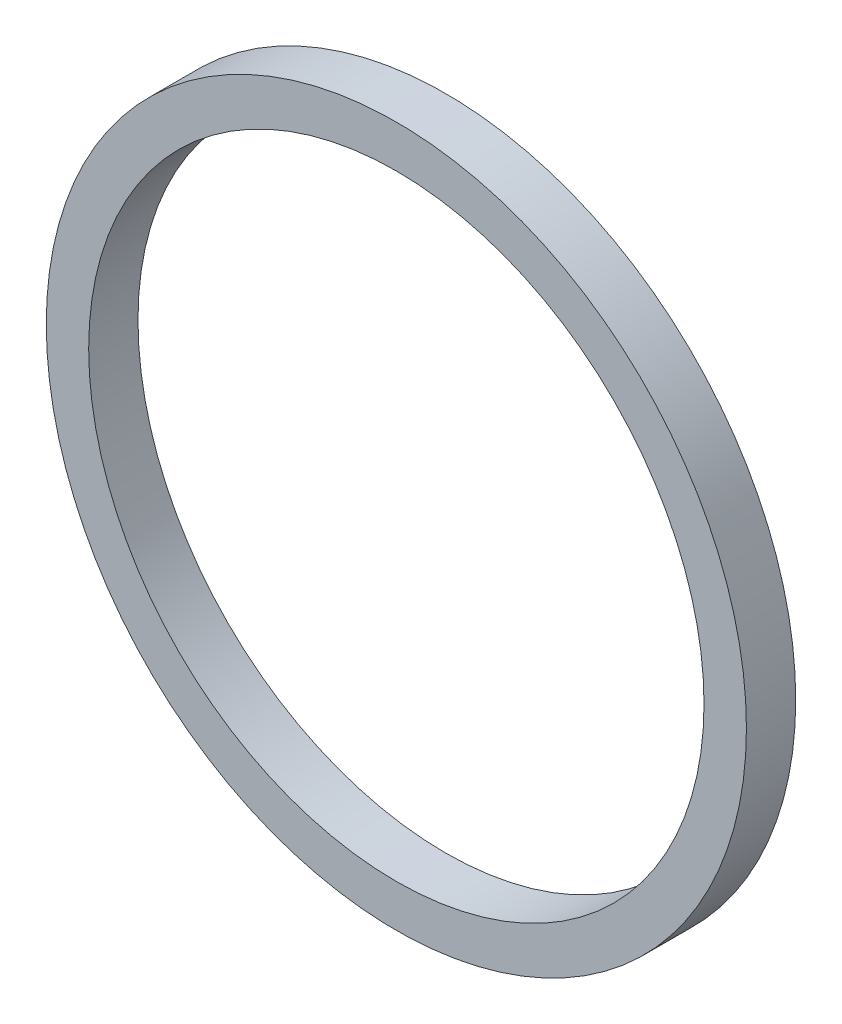
from build123d import *

# Parameters (mm, degrees)
SKETCH1_R           = 22.5425
SKETCH1_R_2         = 19.812
BOSS_EXTRUDE1_DEPTH = 3.175


with BuildPart() as part:
    # Sketch1 → Boss-Extrude1 (new body)
    with BuildSketch(Plane.XY):
        Circle(SKETCH1_R)
        Circle(SKETCH1_R_2, mode=Mode.SUBTRACT)
    extrude(amount=BOSS_EXTRUDE1_DEPTH)


solid = part.part
